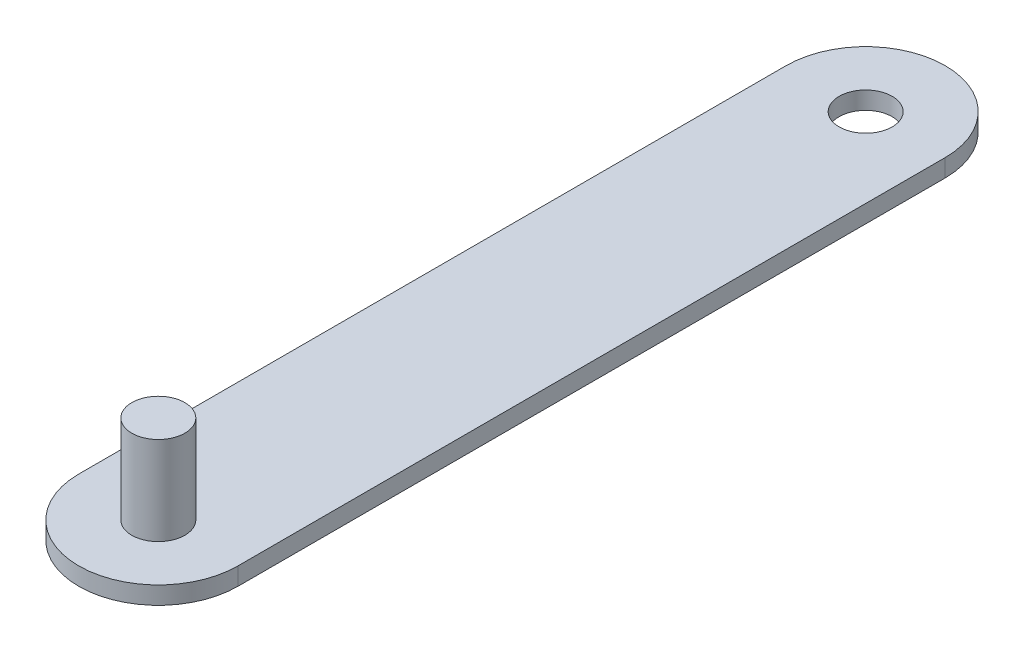
from build123d import *

# Parameters (mm, degrees)
BOSS_EXTRUDE1_DEPTH = 50
SKETCH2_R           = 75
BOSS_EXTRUDE2_DEPTH = 250
SKETCH3_R           = 75
CUT_EXTRUDE2_DEPTH  = 250


with BuildPart() as part:
    # Sketch1 → Boss-Extrude1 (new body)
    with BuildSketch(Plane(origin=(0, 0, 0), x_dir=(1, 0, 0), z_dir=(0, 1, 0))):
        with BuildLine():
            Line((-225, 1000), (-225, -1000))
            ThreePointArc((-225, -1000), (0, -1225), (225, -1000))
            Line((225, -1000), (225, 1000))
            ThreePointArc((225, 1000), (0, 1225), (-225, 1000))
        make_face()
    extrude(amount=BOSS_EXTRUDE1_DEPTH)

    # Sketch2 → Boss-Extrude2 (add)
    with BuildSketch(Plane(origin=(0, 50, 0), x_dir=(1, 0, 0), z_dir=(0, 1, 0))):
        with Locations((0, -1000)):
            Circle(SKETCH2_R)
    extrude(amount=BOSS_EXTRUDE2_DEPTH)

    # Sketch3 → Cut-Extrude2 (cut)
    with BuildSketch(Plane(origin=(0, 50, 0), x_dir=(1, 0, 0), z_dir=(0, 1, 0))):
        with Locations((0, 1000)):
            Circle(SKETCH3_R)
    extrude(amount=-CUT_EXTRUDE2_DEPTH, mode=Mode.SUBTRACT)


solid = part.part
